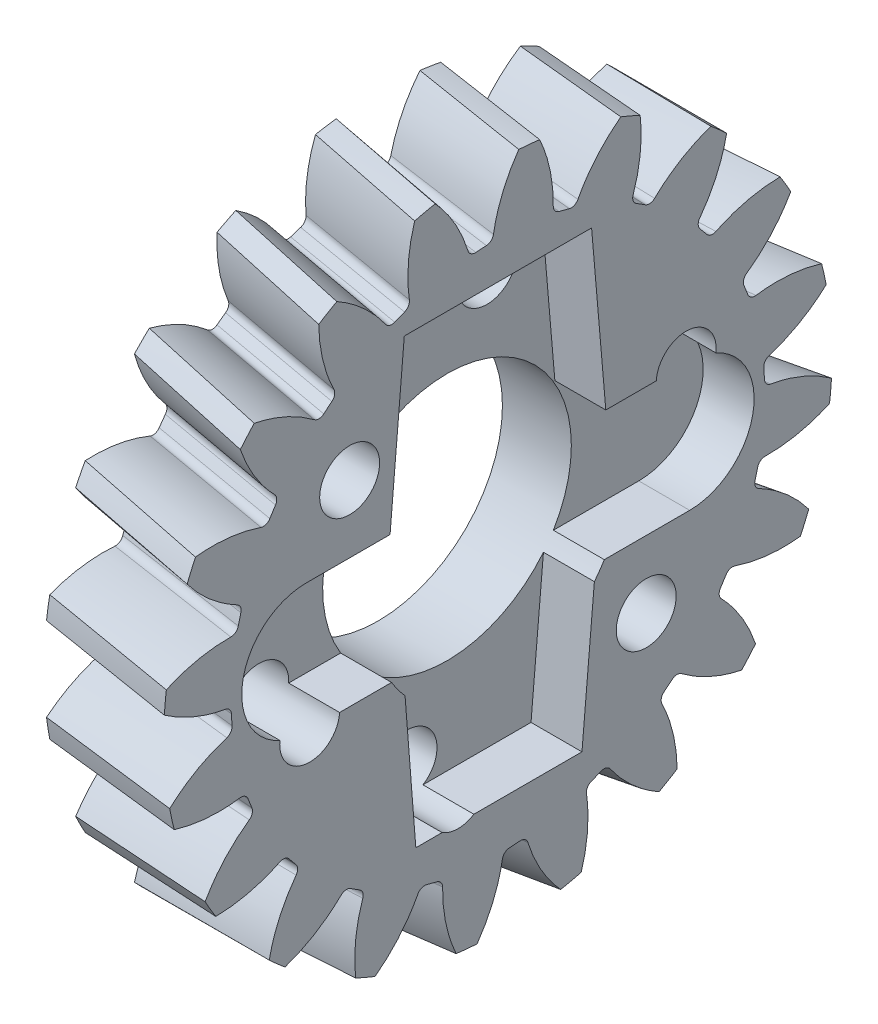
from build123d import *

# Parameters (mm, degrees)
BASPROSKE_W                     = 4
BASPROSKE_H                     = 11.154266119
TOOTHCUTRH_PITCH                = 397.467935473
TOOTHCUTRH_HEIGHT               = 4
TOOTHCUTRH_RADIUS               = 11.154266119
TOOTHCUTRH_START_ANGLE          = -90
TEETHCUTSRH_COUNT               = 20
TEETHCUTSRH_ANGLE               = 342
BORSKE_R                        = 3
BORE_DEPTH                      = 62.5000025
SKIZZE1_R                       = 4.15
LOCH_DEPTH                      = 17.244020749
LASCHEN_RUND_DEPTH              = 1.7
LASCHE_GROSS_ECKIG_DEPTH        = 1.7
SCHNITT_LINEAR_AUSTRAGEN4_DEPTH = 1.7
SKIZZE7_R                       = 1
LOCH_OPTION_DEPTH               = 17.244021148
KREISMUSTER1_COUNT              = 6


with BuildPart() as part:
    # BasProSke → Base-Revolve (revolve)
    with BuildSketch(Plane(origin=(0, 0, 0), x_dir=(1, 0, 0), z_dir=(0, 1, 0)), mode=Mode.PRIVATE) as base_revolve_sk:
        with Locations((2, 5.57713306)):
            Rectangle(BASPROSKE_W, BASPROSKE_H)
    revolve(base_revolve_sk.sketch.rotate(Axis((-10, 0, 0), (1, 0, 0)), 180), axis=Axis((-10, 0, 0), (1, 0, 0)))

    # ToothCutRH: sweep along a helix
    with BuildLine() as toothcutrh_path:
        add(Helix(TOOTHCUTRH_PITCH, TOOTHCUTRH_HEIGHT, TOOTHCUTRH_RADIUS, center=(0, 0, 0), direction=(1, 0, 0), mode=Mode.PRIVATE).rotate(Axis((0, 0, 0), (1, 0, 0)), TOOTHCUTRH_START_ANGLE))
    # TooCutSkeRH → ToothCutRH (sweep, cut)
    with BuildSketch(Plane(origin=(0, 0, 0), x_dir=(0, 0, -1), z_dir=(1, 0, 0))):
        with BuildLine():
            ThreePointArc((0.176132075, 8.902523946), (0, 8.904266119), (-0.176132075, 8.902523946))
            ThreePointArc((-0.176132075, 8.902523946), (-0.334445137, 8.954765617), (-0.425110314, 9.094665737))
            ThreePointArc((-0.425110314, 9.094665737), (-0.893917111, 10.312771472), (-1.662006655, 11.368043876))
            ThreePointArc((-1.662006655, 11.368043876), (0, 11.488894102), (1.662006655, 11.368043876))
            ThreePointArc((1.662006655, 11.368043876), (0.893917111, 10.312771472), (0.425110314, 9.094665737))
            ThreePointArc((0.425110314, 9.094665737), (0.334445137, 8.954765617), (0.176132075, 8.902523946))
        make_face()
    toothcutrh = sweep(path=toothcutrh_path.line, is_frenet=True, mode=Mode.SUBTRACT)

    # TeethCutsRH: ToothCutRH ×20 about axis
    teethcutsrh_axis = Axis((-10, 0, 0), (1, 0, 0))
    for i in range(1, TEETHCUTSRH_COUNT):
        add(toothcutrh.rotate(teethcutsrh_axis, i * TEETHCUTSRH_ANGLE / (TEETHCUTSRH_COUNT - 1)), mode=Mode.SUBTRACT)

    # BorSke → Bore (cut, symmetric)
    with BuildSketch(Plane(origin=(0, 0, 0), x_dir=(0, 0, -1), z_dir=(1, 0, 0))):
        with Locations(Location((0, 0, 0), (0, 0, 180))):
            Circle(BORSKE_R)
    extrude(amount=BORE_DEPTH, both=True, mode=Mode.SUBTRACT)

    # Skizze1 → loch (cut, through all)
    with BuildSketch(Plane(origin=(4, 0, 0), x_dir=(0, 0, -1), z_dir=(1, 0, 0))):
        Circle(SKIZZE1_R)
    extrude(amount=-LOCH_DEPTH, mode=Mode.SUBTRACT)

    # Skizze2 → laschen rund (cut)
    with BuildSketch(Plane(origin=(4, 0, 0), x_dir=(0, 0, -1), z_dir=(1, 0, 0))):
        with BuildLine():
            Line((-6.4, 2.15), (6.4, 2.15))
            ThreePointArc((6.4, 2.15), (8.55, 0), (6.4, -2.15))
            Line((6.4, -2.15), (-6.4, -2.15))
            ThreePointArc((-6.4, -2.15), (-8.55, 0), (-6.4, 2.15))
        make_face()
    extrude(amount=-LASCHEN_RUND_DEPTH, mode=Mode.SUBTRACT)

    # Skizze5 → lasche gross eckig (cut)
    with BuildSketch(Plane(origin=(4, 0, 0), x_dir=(0, 0, -1), z_dir=(1, 0, 0))):
        Polygon((-3.125502306, 7.65), (-3.6, 2.15), (3.6, 2.15), (3.125502306, 7.65), align=None)
    extrude(amount=-LASCHE_GROSS_ECKIG_DEPTH, mode=Mode.SUBTRACT)

    # Skizze6 → Schnitt-Linear austragen4 (cut)
    with BuildSketch(Plane(origin=(4, 0, 0), x_dir=(0, 0, -1), z_dir=(1, 0, 0))):
        Polygon((-3.144670941, -2.194021559), (-2.740477844, -7.332363985), (2.804249033, -7.332363985), (3.255322421, -2.203238944), align=None)
    extrude(amount=-SCHNITT_LINEAR_AUSTRAGEN4_DEPTH, mode=Mode.SUBTRACT)

    # Skizze7 → loch option (cut, through all)
    with BuildSketch(Plane.ZY):
        with Locations((1.333158904, -6.48479628)):
            Circle(SKIZZE7_R)
    loch_option = extrude(amount=-LOCH_OPTION_DEPTH, mode=Mode.SUBTRACT)

    # Kreismuster1: loch option ×6 about axis
    kreismuster1_axis = Axis((0, 0, 0), (1, 0, 0))
    for i in range(1, KREISMUSTER1_COUNT):
        add(loch_option.rotate(kreismuster1_axis, i * 360 / KREISMUSTER1_COUNT), mode=Mode.SUBTRACT)


solid = part.part
